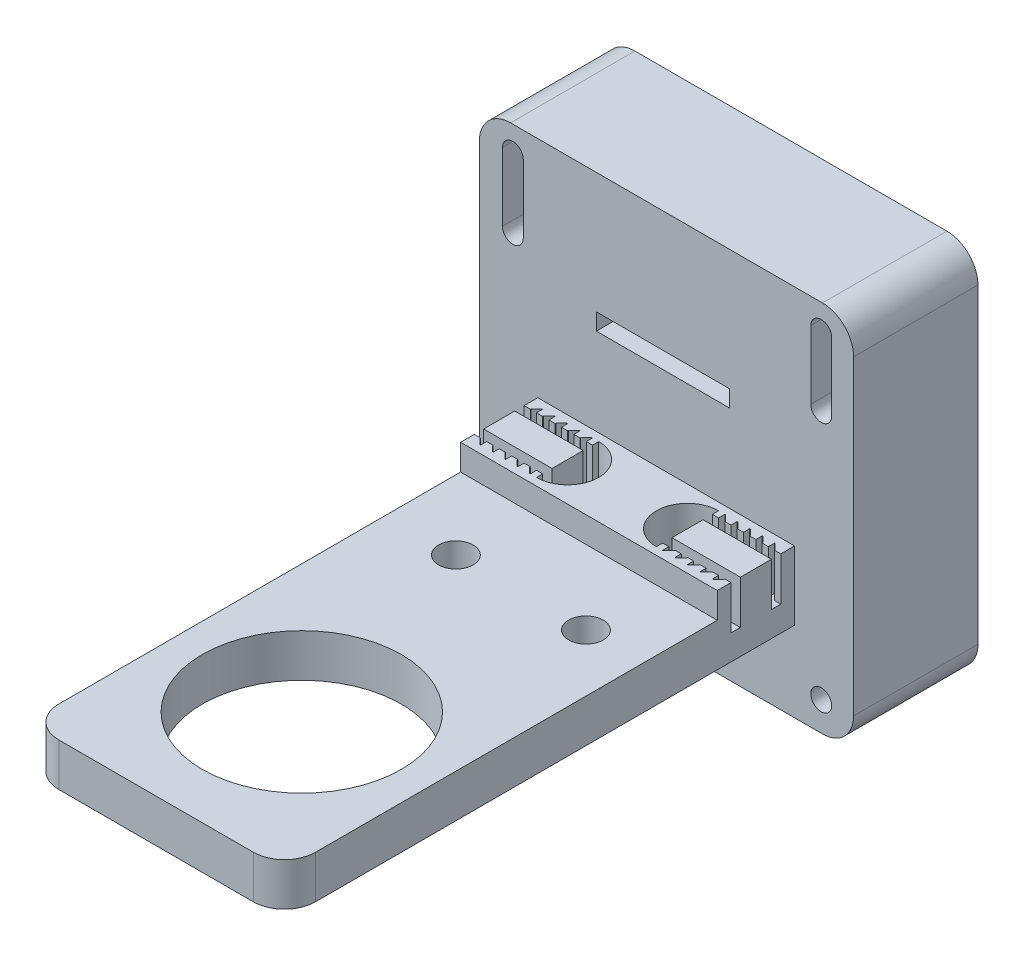
from build123d import *

# Parameters (mm, degrees)
CROQUIS1_W              = 60.14528302
CROQUIS1_H              = 60
CROQUIS1_R              = 1.678683546
CROQUIS1_W_2            = 21.375237152
CROQUIS1_H_2            = 2.685893673
SALIENTE_EXTRUIR1_DEPTH = 20
CROQUIS2_W              = 41.265919314
CROQUIS2_H              = 11.047137426
SALIENTE_EXTRUIR2_DEPTH = 82
CROQUIS3_W              = 22.519164753
CROQUIS3_H              = 7.541795743
CORTAR_EXTRUIR1_DEPTH   = 50
CROQUIS4_R              = 2.778810817
CORTAR_EXTRUIR2_DEPTH   = 52
REDONDEO1_R             = 5
REDONDEO2_R             = 5
CROQUIS5_R              = 16
CORTAR_EXTRUIR3_DEPTH   = 20
CROQUIS7_W              = 52.537645902
CROQUIS7_H              = 4.142676535
CORTAR_EXTRUIR4_DEPTH   = 62
CORTAR_EXTRUIR5_DEPTH   = 7


with BuildPart() as part:
    # Croquis1 → Saliente-Extruir1 (new body)
    with BuildSketch(Plane.XY):
        with Locations((3.000280638, -1.75)):
            Rectangle(CROQUIS1_W, CROQUIS1_H)
        with Locations((27.873314814, -27.085103986)):
            Circle(CROQUIS1_R, mode=Mode.SUBTRACT)
        with Locations((-21.703805911, -27.085103986)):
            Circle(CROQUIS1_R, mode=Mode.SUBTRACT)
        with Locations((2.413281033, 7.495777062)):
            Rectangle(CROQUIS1_W_2, CROQUIS1_H_2, mode=Mode.SUBTRACT)
        with BuildLine():
            Line((-20.025122365, 24.170700285), (-20.025122365, 13.203301118))
            ThreePointArc((-20.025122365, 13.203301118), (-21.703805911, 11.524617572), (-23.382489457, 13.203301118))
            Line((-23.382489457, 13.203301118), (-23.382489457, 24.170700285))
            ThreePointArc((-23.382489457, 24.170700285), (-21.703805911, 25.849383831), (-20.025122365, 24.170700285))
        make_face(mode=Mode.SUBTRACT)
        with BuildLine():
            Line((29.55199836, 24.170700285), (29.55199836, 13.203301118))
            ThreePointArc((29.55199836, 13.203301118), (27.873314814, 11.524617572), (26.194631268, 13.203301118))
            Line((26.194631268, 13.203301118), (26.194631268, 24.170700285))
            ThreePointArc((26.194631268, 24.170700285), (27.873314814, 25.849383831), (29.55199836, 24.170700285))
        make_face(mode=Mode.SUBTRACT)
    extrude(amount=SALIENTE_EXTRUIR1_DEPTH)

    # Croquis2 → Saliente-Extruir2 (add)
    with BuildSketch(Plane.XY.offset(20)):
        with Locations((2.946265977, -13.343146768)):
            Rectangle(CROQUIS2_W, CROQUIS2_H)
    extrude(amount=SALIENTE_EXTRUIR2_DEPTH)

    # Croquis3 → Cortar-Extruir1 (cut)
    with BuildSketch(Plane(origin=(23.579225634, 0, 0), x_dir=(0, 0, -1), z_dir=(1, 0, 0))):
        with Locations((-43.67389367, -8.191356718)):
            Rectangle(CROQUIS3_W, CROQUIS3_H)
    extrude(amount=-CORTAR_EXTRUIR1_DEPTH, mode=Mode.SUBTRACT)

    # Croquis4 → Cortar-Extruir2 (cut)
    with BuildSketch(Plane.XZ.offset(18.866715481)):
        with Locations((-6.523695114, 44.333086762)):
            Circle(CROQUIS4_R)
        with Locations((14.386898359, 44.333086762)):
            Circle(CROQUIS4_R)
    extrude(amount=-CORTAR_EXTRUIR2_DEPTH, mode=Mode.SUBTRACT)

    # Redondeo1
    redondeo1_edges = [part.edges().sort_by_distance(p)[0] for p in [
        (-17.68669368, -13.343146768, 102),
        (23.579225634, -13.343146768, 102),
    ]]
    fillet(redondeo1_edges, radius=REDONDEO1_R)

    # Redondeo2
    redondeo2_edges = [part.edges().sort_by_distance(p)[0] for p in [
        (-27.072360872, 28.25, 10),
        (33.072922148, 28.25, 10),
        (-27.072360872, -31.75, 10),
        (33.072922148, -31.75, 10),
    ]]
    fillet(redondeo2_edges, radius=REDONDEO2_R)

    # Croquis5 → Cortar-Extruir3 (cut)
    with BuildSketch(Plane(origin=(0, -7.819578055, 0), x_dir=(1, 0, 0), z_dir=(0, 1, 0))):
        with Locations((2.946265977, -78.573452579)):
            Circle(CROQUIS5_R)
    extrude(amount=-CORTAR_EXTRUIR3_DEPTH, mode=Mode.SUBTRACT)

    # Croquis7 → Cortar-Extruir4 (cut)
    with BuildSketch(Plane.ZY.offset(17.68669368)):
        with Locations((81.202298997, -9.890916323)):
            Rectangle(CROQUIS7_W, CROQUIS7_H)
    extrude(amount=-CORTAR_EXTRUIR4_DEPTH, mode=Mode.SUBTRACT)

    # Croquis8 → Cortar-Extruir5 (cut)
    with BuildSketch(Plane(origin=(0, -7.819578055, 0), x_dir=(1, 0, 0), z_dir=(0, 1, 0))):
        with BuildLine():
            Line((-8.68669368, -30.207155647), (-8.68669368, -30.307155647))
            Line((-8.68669368, -30.307155647), (-7.78669368, -31.207155647))
            Line((-7.78669368, -31.207155647), (-7.68669368, -31.207155647))
            Line((-7.68669368, -31.207155647), (-7.68669368, -30.207155647))
            Line((-7.68669368, -30.207155647), (-6.68669368, -30.207155647))
            Line((-6.68669368, -30.207155647), (-6.68669368, -31.207155647))
            ThreePointArc((-6.68669368, -31.207155647), (-1.68669368, -26.207155647), (-6.68669368, -21.207155647))
            Line((-6.68669368, -21.207155647), (-6.68669368, -22.207155647))
            Line((-6.68669368, -22.207155647), (-7.68669368, -22.207155647))
            Line((-7.68669368, -22.207155647), (-7.68669368, -21.207155647))
            Line((-7.68669368, -21.207155647), (-7.78669368, -21.207155647))
            Line((-7.78669368, -21.207155647), (-8.68669368, -22.107155647))
            Line((-8.68669368, -22.107155647), (-8.68669368, -22.207155647))
            Line((-8.68669368, -22.207155647), (-9.68669368, -22.207155647))
            Line((-9.68669368, -22.207155647), (-9.68669368, -21.207155647))
            Line((-9.68669368, -21.207155647), (-9.78669368, -21.207155647))
            Line((-9.78669368, -21.207155647), (-10.68669368, -22.107155647))
            Line((-10.68669368, -22.107155647), (-10.68669368, -22.207155647))
            Line((-10.68669368, -22.207155647), (-11.68669368, -22.207155647))
            Line((-11.68669368, -22.207155647), (-11.68669368, -21.207155647))
            Line((-11.68669368, -21.207155647), (-11.78669368, -21.207155647))
            Line((-11.78669368, -21.207155647), (-12.68669368, -22.107155647))
            Line((-12.68669368, -22.107155647), (-12.68669368, -22.207155647))
            Line((-12.68669368, -22.207155647), (-13.68669368, -22.207155647))
            Line((-13.68669368, -22.207155647), (-13.68669368, -21.207155647))
            Line((-13.68669368, -21.207155647), (-13.78669368, -21.207155647))
            Line((-13.78669368, -21.207155647), (-14.68669368, -22.107155647))
            Line((-14.68669368, -22.107155647), (-14.68669368, -22.207155647))
            Line((-14.68669368, -22.207155647), (-15.68669368, -22.207155647))
            Line((-15.68669368, -22.207155647), (-15.68669368, -21.207155647))
            Line((-15.68669368, -21.207155647), (-15.78669368, -21.207155647))
            Line((-15.78669368, -21.207155647), (-16.68669368, -22.107155647))
            Line((-16.68669368, -22.107155647), (-16.68669368, -22.207155647))
            Line((-16.68669368, -22.207155647), (-17.68669368, -22.207155647))
            Line((-17.68669368, -22.207155647), (-17.68669368, -23.707155647))
            Line((-17.68669368, -23.707155647), (-6.68669368, -23.707155647))
            Line((-6.68669368, -23.707155647), (-6.68669368, -28.707155647))
            Line((-6.68669368, -28.707155647), (-17.68669368, -28.707155647))
            Line((-17.68669368, -28.707155647), (-17.68669368, -30.207155647))
            Line((-17.68669368, -30.207155647), (-16.68669368, -30.207155647))
            Line((-16.68669368, -30.207155647), (-16.68669368, -30.307155647))
            Line((-16.68669368, -30.307155647), (-15.78669368, -31.207155647))
            Line((-15.78669368, -31.207155647), (-15.68669368, -31.207155647))
            Line((-15.68669368, -31.207155647), (-15.68669368, -30.207155647))
            Line((-15.68669368, -30.207155647), (-14.68669368, -30.207155647))
            Line((-14.68669368, -30.207155647), (-14.68669368, -30.307155647))
            Line((-14.68669368, -30.307155647), (-13.78669368, -31.207155647))
            Line((-13.78669368, -31.207155647), (-13.68669368, -31.207155647))
            Line((-13.68669368, -31.207155647), (-13.68669368, -30.207155647))
            Line((-13.68669368, -30.207155647), (-12.68669368, -30.207155647))
            Line((-12.68669368, -30.207155647), (-12.68669368, -30.307155647))
            Line((-12.68669368, -30.307155647), (-11.78669368, -31.207155647))
            Line((-11.78669368, -31.207155647), (-11.68669368, -31.207155647))
            Line((-11.68669368, -31.207155647), (-11.68669368, -30.207155647))
            Line((-11.68669368, -30.207155647), (-10.68669368, -30.207155647))
            Line((-10.68669368, -30.207155647), (-10.68669368, -30.307155647))
            Line((-10.68669368, -30.307155647), (-9.78669368, -31.207155647))
            Line((-9.78669368, -31.207155647), (-9.68669368, -31.207155647))
            Line((-9.68669368, -31.207155647), (-9.68669368, -30.207155647))
            Line((-9.68669368, -30.207155647), (-8.68669368, -30.207155647))
        make_face()
        with BuildLine():
            Line((12.579225634, -31.207155647), (12.579225634, -30.207155647))
            Line((12.579225634, -30.207155647), (13.579225634, -30.207155647))
            Line((13.579225634, -30.207155647), (13.579225634, -31.207155647))
            Line((13.579225634, -31.207155647), (13.679225634, -31.207155647))
            Line((13.679225634, -31.207155647), (14.579225634, -30.307155647))
            Line((14.579225634, -30.307155647), (14.579225634, -30.207155647))
            Line((14.579225634, -30.207155647), (15.579225634, -30.207155647))
            Line((15.579225634, -30.207155647), (15.579225634, -31.207155647))
            Line((15.579225634, -31.207155647), (15.679225634, -31.207155647))
            Line((15.679225634, -31.207155647), (16.579225634, -30.307155647))
            Line((16.579225634, -30.307155647), (16.579225634, -30.207155647))
            Line((16.579225634, -30.207155647), (17.579225634, -30.207155647))
            Line((17.579225634, -30.207155647), (17.579225634, -31.207155647))
            Line((17.579225634, -31.207155647), (17.679225634, -31.207155647))
            Line((17.679225634, -31.207155647), (18.579225634, -30.307155647))
            Line((18.579225634, -30.307155647), (18.579225634, -30.207155647))
            Line((18.579225634, -30.207155647), (19.579225634, -30.207155647))
            Line((19.579225634, -30.207155647), (19.579225634, -31.207155647))
            Line((19.579225634, -31.207155647), (19.679225634, -31.207155647))
            Line((19.679225634, -31.207155647), (20.579225634, -30.307155647))
            Line((20.579225634, -30.307155647), (20.579225634, -30.207155647))
            Line((20.579225634, -30.207155647), (21.579225634, -30.207155647))
            Line((21.579225634, -30.207155647), (21.579225634, -31.207155647))
            Line((21.579225634, -31.207155647), (21.679225634, -31.207155647))
            Line((21.679225634, -31.207155647), (22.579225634, -30.307155647))
            Line((22.579225634, -30.307155647), (22.579225634, -30.207155647))
            Line((22.579225634, -30.207155647), (23.579225634, -30.207155647))
            Line((23.579225634, -30.207155647), (23.579225634, -28.707155647))
            Line((23.579225634, -28.707155647), (12.579225634, -28.707155647))
            Line((12.579225634, -28.707155647), (12.579225634, -23.707155647))
            Line((12.579225634, -23.707155647), (23.579225634, -23.707155647))
            Line((23.579225634, -23.707155647), (23.579225634, -22.207155647))
            Line((23.579225634, -22.207155647), (22.579225634, -22.207155647))
            Line((22.579225634, -22.207155647), (22.579225634, -22.107155647))
            Line((22.579225634, -22.107155647), (21.679225634, -21.207155647))
            Line((21.679225634, -21.207155647), (21.579225634, -21.207155647))
            Line((21.579225634, -21.207155647), (21.579225634, -22.207155647))
            Line((21.579225634, -22.207155647), (20.579225634, -22.207155647))
            Line((20.579225634, -22.207155647), (20.579225634, -22.107155647))
            Line((20.579225634, -22.107155647), (19.679225634, -21.207155647))
            Line((19.679225634, -21.207155647), (19.579225634, -21.207155647))
            Line((19.579225634, -21.207155647), (19.579225634, -22.207155647))
            Line((19.579225634, -22.207155647), (18.579225634, -22.207155647))
            Line((18.579225634, -22.207155647), (18.579225634, -22.107155647))
            Line((18.579225634, -22.107155647), (17.679225634, -21.207155647))
            Line((17.679225634, -21.207155647), (17.579225634, -21.207155647))
            Line((17.579225634, -21.207155647), (17.579225634, -22.207155647))
            Line((17.579225634, -22.207155647), (16.579225634, -22.207155647))
            Line((16.579225634, -22.207155647), (16.579225634, -22.107155647))
            Line((16.579225634, -22.107155647), (15.679225634, -21.207155647))
            Line((15.679225634, -21.207155647), (15.579225634, -21.207155647))
            Line((15.579225634, -21.207155647), (15.579225634, -22.207155647))
            Line((15.579225634, -22.207155647), (14.579225634, -22.207155647))
            Line((14.579225634, -22.207155647), (14.579225634, -22.107155647))
            Line((14.579225634, -22.107155647), (13.679225634, -21.207155647))
            Line((13.679225634, -21.207155647), (13.579225634, -21.207155647))
            Line((13.579225634, -21.207155647), (13.579225634, -22.207155647))
            Line((13.579225634, -22.207155647), (12.579225634, -22.207155647))
            Line((12.579225634, -22.207155647), (12.579225634, -21.207155647))
            ThreePointArc((12.579225634, -21.207155647), (7.579225634, -26.207155647), (12.579225634, -31.207155647))
        make_face()
    extrude(amount=-CORTAR_EXTRUIR5_DEPTH, mode=Mode.SUBTRACT)


solid = part.part
